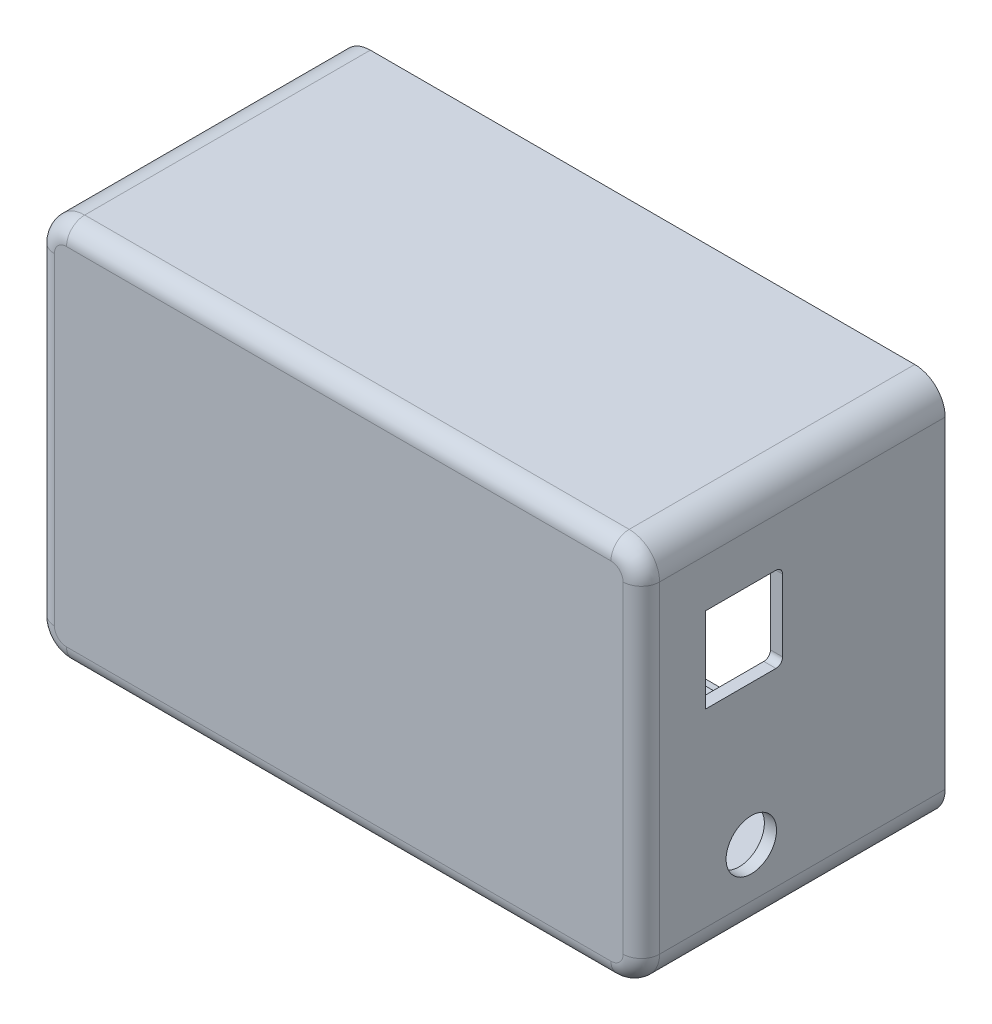
from build123d import *

# Parameters (mm, degrees)
SKETCH2_W           = 99.6
SKETCH2_H           = 63.05
BOSS_EXTRUDE2_DEPTH = 50
FILLET1_R           = 5
FILLET2_R           = 3
SHELL3_T            = -2
CUT_EXTRUDE6_REACH  = 124.024
SKETCH40_R          = 8.8
CUT_EXTRUDE7_REACH  = 124.024
CUT_EXTRUDE8_REACH  = 124.024
SKETCH42_R          = 4.15
SKETCH43_R          = 3.6
SKETCH43_R_2        = 1
BOSS_EXTRUDE3_DEPTH = 8
SKETCH44_R          = 3.6
SKETCH44_R_2        = 1
BOSS_EXTRUDE4_DEPTH = 8
SKETCH45_R          = 3.6
SKETCH45_R_2        = 1
BOSS_EXTRUDE5_DEPTH = 8
SKETCH46_R          = 3.6
SKETCH46_R_2        = 1.6
BOSS_EXTRUDE6_DEPTH = 8
GROOVE1_DEPTH       = 2
GROOVE1_DRAFT       = 3
SKETCH47_R          = 2.8
SKETCH47_R_2        = 0.5
BOSS_EXTRUDE7_DEPTH = 5
CHAMFER1_SIZE       = 2
RIB1_REACH          = 100.505
SKETCH48_WALL_W     = 202.293959528
SKETCH48_WALL_H     = 2
CIRPATTERN1_COUNT   = 5
CIRPATTERN1_ANGLE   = 300


# Read off the part's stored shape, not the designer's step: Groove1
with BuildPart() as part:
    # Sketch2 → Boss-Extrude2 (new body)
    with BuildSketch(Plane.XY.offset(10)):
        with Locations((-46.8, 26.525)):
            Rectangle(SKETCH2_W, SKETCH2_H)
    extrude(amount=-BOSS_EXTRUDE2_DEPTH)

    # Fillet1
    fillet1_edges = [part.edges().sort_by_distance(p)[0] for p in [
        (-96.6, 58.05, -15),
        (3, 58.05, -15),
        (3, -5, -15),
        (-96.6, -5, -15),
    ]]
    fillet(fillet1_edges, radius=FILLET1_R)

    # Fillet2
    fillet2_edges = [part.edges().sort_by_distance(p)[0] for p in [
        (-46.8, -5, 10),
        (-96.6, 26.525, 10),
        (3, 26.525, 10),
        (-46.8, 58.05, 10),
        (-95.135533906, 56.585533906, 10),
        (-95.135533906, -3.535533906, 10),
        (1.535533906, 56.585533906, 10),
        (1.535533906, -3.535533906, 10),
    ]]
    fillet(fillet2_edges, radius=FILLET2_R)

    # Shell3
    shell3_openings = [part.faces().sort_by_distance(p)[0] for p in [
        (-46.8, 26.525, -40),
    ]]
    offset(amount=SHELL3_T, openings=shell3_openings, kind=Kind.INTERSECTION)

    # Sketch40 → Cut-Extrude6 (cut, up to next)
    with BuildSketch(Plane.ZY.offset(96.6), mode=Mode.PRIVATE) as cut_extrude6_sk1:
        with Locations(Location((-21.75, 20, 0), (0, 0, 270))):
            Circle(SKETCH40_R)
    cut_extrude6_tool1 = extrude(cut_extrude6_sk1.sketch, amount=-CUT_EXTRUDE6_REACH, mode=Mode.PRIVATE) & part.part
    # Sketch40 → Cut-Extrude6 (cut, up to next)
    with BuildSketch(Plane.ZY.offset(96.6), mode=Mode.PRIVATE) as cut_extrude6_sk2:
        with Locations(Location((-21.75, 41, 0), (0, 0, 270))):
            Circle(SKETCH40_R)
    cut_extrude6_tool2 = extrude(cut_extrude6_sk2.sketch, amount=-CUT_EXTRUDE6_REACH, mode=Mode.PRIVATE) & part.part
    add(cut_extrude6_tool1.solids().sort_by_distance((-96.6, 20, -21.75))[0], mode=Mode.SUBTRACT)
    add(cut_extrude6_tool2.solids().sort_by_distance((-96.6, 41, -21.75))[0], mode=Mode.SUBTRACT)

    # Sketch41 → Cut-Extrude7 (cut, up to next)
    with BuildSketch(Plane(origin=(3, 0, 0), x_dir=(0, 0, -1), z_dir=(1, 0, 0)), mode=Mode.PRIVATE) as cut_extrude7_sk1:
        with BuildLine():
            Line((0.55, 31.15), (0.55, 45.15))
            Line((0.55, 45.15), (12.15, 45.15))
            ThreePointArc((12.15, 45.15), (12.927817459, 44.827817459), (13.25, 44.05))
            Line((13.25, 44.05), (13.25, 32.25))
            ThreePointArc((13.25, 32.25), (12.927817459, 31.472182541), (12.15, 31.15))
            Line((12.15, 31.15), (0.55, 31.15))
        make_face()
    cut_extrude7_tool1 = extrude(cut_extrude7_sk1.sketch, amount=-CUT_EXTRUDE7_REACH, mode=Mode.PRIVATE) & part.part
    add(cut_extrude7_tool1.solids().sort_by_distance((3, 38.15, -6.882118))[0], mode=Mode.SUBTRACT)

    # Sketch42 → Cut-Extrude8 (cut, up to next)
    with BuildSketch(Plane(origin=(3, 0, 0), x_dir=(0, 0, -1), z_dir=(1, 0, 0)), mode=Mode.PRIVATE) as cut_extrude8_sk1:
        with Locations(Location((8.1, 8.05, 0), (0, 0, 90))):
            Circle(SKETCH42_R)
    cut_extrude8_tool1 = extrude(cut_extrude8_sk1.sketch, amount=-CUT_EXTRUDE8_REACH, mode=Mode.PRIVATE) & part.part
    add(cut_extrude8_tool1.solids().sort_by_distance((3, 8.05, -8.1))[0], mode=Mode.SUBTRACT)

    # Sketch43 → Boss-Extrude3 (add)
    with BuildSketch(Plane(origin=(0, 0, 8), x_dir=(-1, 0, 0), z_dir=(0, 0, -1))):
        with Locations(Location((65.8, 7.6, 0), (0, 0, 180))):
            Circle(SKETCH43_R)
        with Locations(Location((65.8, 7.6, 0), (0, 0, 270))):
            Circle(SKETCH43_R_2, mode=Mode.SUBTRACT)
    extrude(amount=BOSS_EXTRUDE3_DEPTH)

    # Sketch44 → Boss-Extrude4 (add)
    with BuildSketch(Plane(origin=(0, 0, 8), x_dir=(-1, 0, 0), z_dir=(0, 0, -1))):
        with Locations(Location((65.8, 35.55, 0), (0, 0, 180))):
            Circle(SKETCH44_R)
        with Locations(Location((65.8, 35.55, 0), (0, 0, 270))):
            Circle(SKETCH44_R_2, mode=Mode.SUBTRACT)
    extrude(amount=BOSS_EXTRUDE4_DEPTH)

    # Sketch45 → Boss-Extrude5 (add)
    with BuildSketch(Plane(origin=(0, 0, 8), x_dir=(-1, 0, 0), z_dir=(0, 0, -1))):
        with Locations(Location((13.6, 2.4, 0), (0, 0, 180))):
            Circle(SKETCH45_R)
        with Locations(Location((13.6, 2.4, 0), (0, 0, 180))):
            Circle(SKETCH45_R_2, mode=Mode.SUBTRACT)
    extrude(amount=BOSS_EXTRUDE5_DEPTH)

    # Sketch46 → Boss-Extrude6 (add)
    with BuildSketch(Plane(origin=(0, 0, 8), x_dir=(-1, 0, 0), z_dir=(0, 0, -1))):
        with Locations(Location((15, 50.7, 0), (0, 0, 180))):
            Circle(SKETCH46_R)
        with Locations(Location((15, 50.7, 0), (0, 0, 270))):
            Circle(SKETCH46_R_2, mode=Mode.SUBTRACT)
    extrude(amount=BOSS_EXTRUDE6_DEPTH)


with BuildPart() as groove1_tool:
    # Groove1 outline → Groove1 (with draft: the straight prism first)
    with BuildSketch(Plane.XY.offset(-38)):
        with BuildLine():
            ThreePointArc((-2, -3.895184441), (0.754311333, -2.754311333), (1.895184441, 0))
            Line((1.895184441, 0), (1.895184441, 53.05))
            ThreePointArc((1.895184441, 53.05), (0.754311333, 55.804311333), (-2, 56.945184441))
            Line((-2, 56.945184441), (-91.6, 56.945184441))
            ThreePointArc((-91.6, 56.945184441), (-94.354311333, 55.804311333), (-95.495184441, 53.05))
            Line((-95.495184441, 53.05), (-95.495184441, 0))
            ThreePointArc((-95.495184441, 0), (-94.354311333, -2.754311333), (-91.6, -3.895184441))
            Line((-91.6, -3.895184441), (-2, -3.895184441))
        make_face()
        with BuildLine():
            Line((1, 0), (1, 53.05))
            ThreePointArc((1, 53.05), (0.121320344, 55.171320344), (-2, 56.05))
            Line((-2, 56.05), (-91.6, 56.05))
            ThreePointArc((-91.6, 56.05), (-93.721320344, 55.171320344), (-94.6, 53.05))
            Line((-94.6, 53.05), (-94.6, 0))
            ThreePointArc((-94.6, 0), (-93.721320344, -2.121320344), (-91.6, -3))
            Line((-91.6, -3), (-2, -3))
            ThreePointArc((-2, -3), (0.121320344, -2.121320344), (1, 0))
        make_face(mode=Mode.SUBTRACT)
    extrude(amount=-GROOVE1_DEPTH)
    # Groove1: the draft: its side faces are tilted about the plane it starts from
    groove1_sides = [groove1_tool.faces().sort_by_distance(p)[0] for p in [
        (-46.8, -3.895184441, -39),
        (0.754311333, -2.754311333, -39),
        (1.895184441, 26.525, -39),
        (0.754311333, 55.804311333, -39),
        (-46.8, 56.945184441, -39),
        (-94.354311333, 55.804311333, -39),
        (-95.495184441, 26.525, -39),
        (-94.354311333, -2.754311333, -39),
        (-93.721320344, -2.121320344, -39),
        (-94.6, 26.525, -39),
        (-93.721320344, 55.171320344, -39),
        (-46.8, 56.05, -39),
        (0.121320344, 55.171320344, -39),
        (1, 26.525, -39),
        (0.121320344, -2.121320344, -39),
        (-46.8, -3, -39),
    ]]
    draft(groove1_sides, Plane.XY.offset(-38), GROOVE1_DRAFT)


with BuildPart() as part_1:
    add(part.part)

    # Groove1: cut by groove1_tool
    add(groove1_tool.part, mode=Mode.SUBTRACT)

    # Sketch47 → Boss-Extrude7 (add)
    # profile 1 of 4: a face of its own
    with BuildSketch(Plane(origin=(-94.6, 0, 0), x_dir=(0, 0, -1), z_dir=(1, 0, 0))):
        with Locations(Location((30.65, 11.3, 0), (0, 0, 270))):
            Circle(SKETCH47_R)
        with Locations(Location((30.65, 11.3, 0), (0, 0, 270))):
            Circle(SKETCH47_R_2, mode=Mode.SUBTRACT)
    # profile 2 of 4: a face of its own
    with BuildSketch(Plane(origin=(-94.6, 0, 0), x_dir=(0, 0, -1), z_dir=(1, 0, 0))):
        with Locations(Location((12.85, 11.3, 0), (0, 0, 270))):
            Circle(SKETCH47_R)
        with Locations(Location((12.85, 11.3, 0), (0, 0, 270))):
            Circle(SKETCH47_R_2, mode=Mode.SUBTRACT)
    # profile 3 of 4: a face of its own
    with BuildSketch(Plane(origin=(-94.6, 0, 0), x_dir=(0, 0, -1), z_dir=(1, 0, 0))):
        with Locations(Location((12.85, 49.7, 0), (0, 0, 270))):
            Circle(SKETCH47_R)
        with Locations(Location((12.85, 49.7, 0), (0, 0, 270))):
            Circle(SKETCH47_R_2, mode=Mode.SUBTRACT)
    # profile 4 of 4: a face of its own
    with BuildSketch(Plane(origin=(-94.6, 0, 0), x_dir=(0, 0, -1), z_dir=(1, 0, 0))):
        with Locations(Location((30.65, 49.7, 0), (0, 0, 270))):
            Circle(SKETCH47_R)
        with Locations(Location((30.65, 49.7, 0), (0, 0, 270))):
            Circle(SKETCH47_R_2, mode=Mode.SUBTRACT)
    extrude(amount=BOSS_EXTRUDE7_DEPTH)

    # Chamfer1
    chamfer1_edges = [part_1.edges().sort_by_distance(p)[0] for p in [
        (-69.4, 35.55, 8),
    ]]
    chamfer(chamfer1_edges, length=CHAMFER1_SIZE)

    # Sketch48 wall → Rib1 (add, up to next)
    with BuildSketch(Plane(origin=(-65.8, 12.019011316, 4.327943694), x_dir=(0, 0.573576436395, 0.819152044258), z_dir=(0, 0.819152044258, -0.573576436395)), mode=Mode.PRIVATE) as rib1_sk1:
        Rectangle(SKETCH48_WALL_W, SKETCH48_WALL_H)
    rib1_tool1 = extrude(rib1_sk1.sketch, amount=-RIB1_REACH, mode=Mode.PRIVATE) - part_1.part
    rib1 = rib1_tool1.solids().sort_by_distance((-65.8, 12.019011316, 4.327943694))[0]
    add(rib1)

    # CirPattern1: Rib1 ×5 about axis
    cirpattern1_axis = Axis((-65.8, 7.6, 0), (0, 0, 1))
    for i in range(1, CIRPATTERN1_COUNT):
        add(rib1.rotate(cirpattern1_axis, i * CIRPATTERN1_ANGLE / (CIRPATTERN1_COUNT - 1)))


solid = part_1.part
